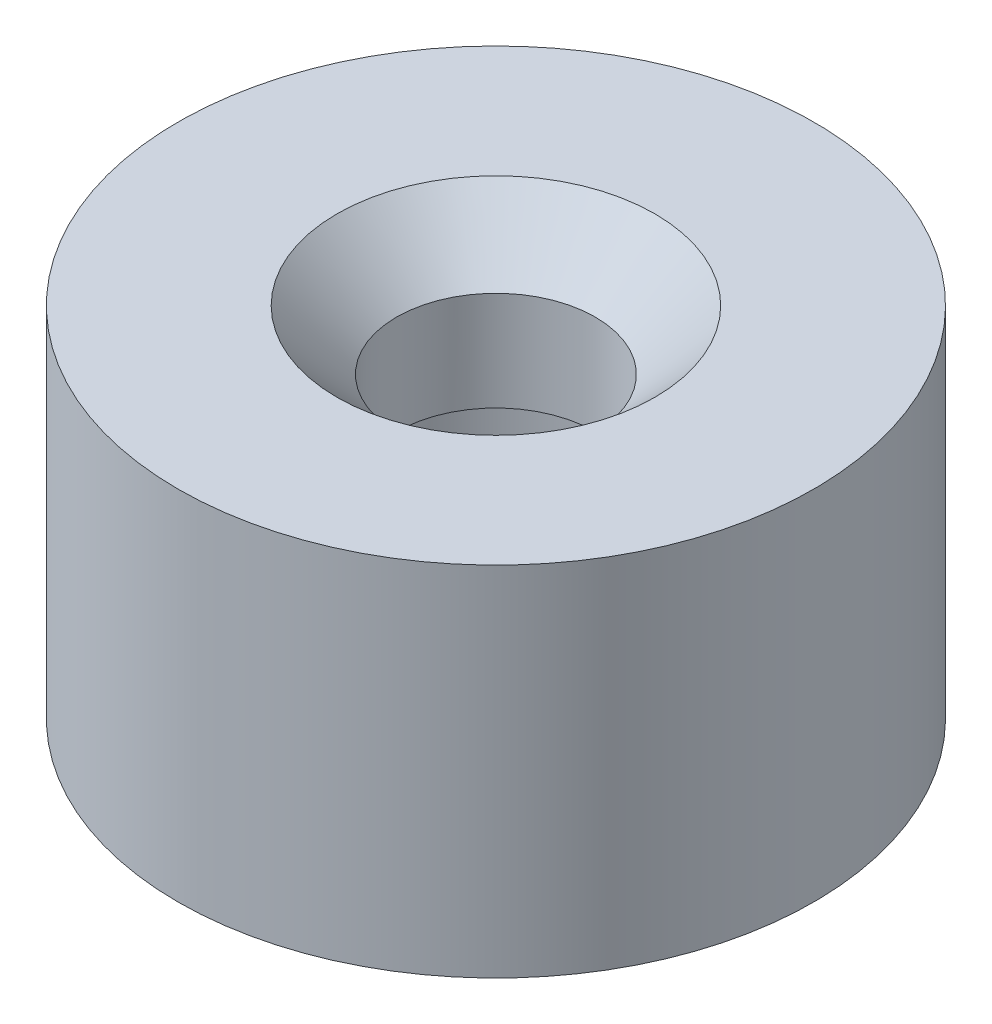
from build123d import *

# Parameters (mm, degrees)
SKETCH1_R           = 8
SKETCH1_R_2         = 2.5
BOSS_EXTRUDE1_DEPTH = 9
SKETCH2_R           = 4
CUT_EXTRUDE1_DEPTH  = 2
CUT_EXTRUDE1_DRAFT  = -45
SKETCH3_R           = 4
CUT_EXTRUDE2_DEPTH  = 5


with BuildPart() as part:
    # Sketch1 → Boss-Extrude1 (new body)
    with BuildSketch(Plane(origin=(0, 0, 0), x_dir=(1, 0, 0), z_dir=(0, 1, 0))):
        Circle(SKETCH1_R)
        Circle(SKETCH1_R_2, mode=Mode.SUBTRACT)
    extrude(amount=BOSS_EXTRUDE1_DEPTH)


with BuildPart() as cut_extrude1_tool:
    # Sketch2 → Cut-Extrude1 (with draft: the straight prism first)
    with BuildSketch(Plane(origin=(0, 9, 0), x_dir=(1, 0, 0), z_dir=(0, 1, 0))):
        Circle(SKETCH2_R)
    extrude(amount=-CUT_EXTRUDE1_DEPTH)
    # Cut-Extrude1: the draft: its side faces are tilted about the plane it starts from
    cut_extrude1_sides = [cut_extrude1_tool.faces().sort_by_distance(p)[0] for p in [
        (-4, 8, 0),
    ]]
    draft(cut_extrude1_sides, Plane(origin=(0, 9, 0), x_dir=(1, 0, 0), z_dir=(0, 1, 0)), CUT_EXTRUDE1_DRAFT)


with BuildPart() as part_1:
    add(part.part)

    # Cut-Extrude1: cut by cut_extrude1_tool
    add(cut_extrude1_tool.part, mode=Mode.SUBTRACT)

    # Sketch3 → Cut-Extrude2 (cut)
    with BuildSketch(Plane(origin=(0, 0, 0), x_dir=(-1, 0, 0), z_dir=(0, -1, 0))):
        Circle(SKETCH3_R)
    extrude(amount=-CUT_EXTRUDE2_DEPTH, mode=Mode.SUBTRACT)


solid = part_1.part
